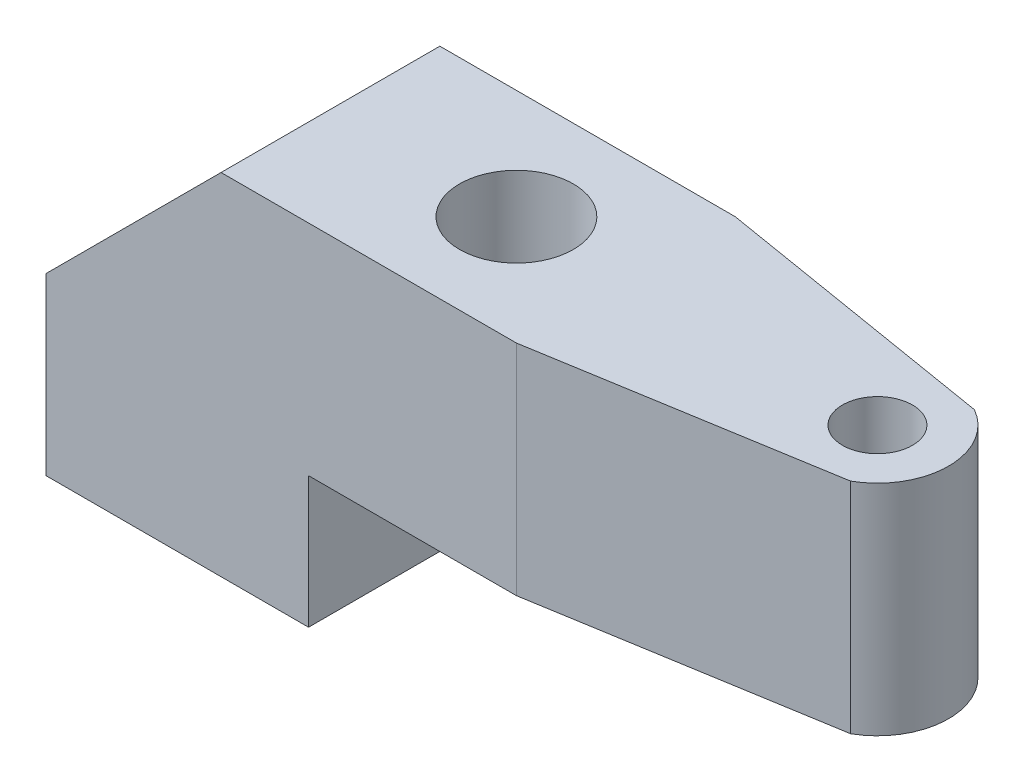
from build123d import *

# Parameters (mm, degrees)
SKETCH1_R             = 5.9875
SKETCH1_R_2           = 1.7
SKETCH1_R_3           = 1.6
BOSS_EXTRUDE1_DEPTH   = 6
MOVE_FACE1_BY         = 5
MOVE_FACE1_2_BY       = 5
MOVE_FACE1_3_BY       = 5
MOVE_FACE1_4_BY       = 5
M4X0_7_TAPPED_HOLE2_D = 3.3
POCKET_WALLS_DEPTH    = 2.6
RIB_PATTERN_DEPTH     = 3
MOVE_FACE2_BY         = 4.5
MOVE_FACE2_2_BY       = 4.5
MOVE_FACE2_3_BY       = 4.5
MOVE_FACE2_4_BY       = 4.5
MOVE_FACE2_5_BY       = 4.5
MOVE_FACE2_6_BY       = 4.5
MOVE_FACE2_7_BY       = 4.5
MOVE_FACE2_8_BY       = 4.5
MOVE_FACE2_9_BY       = 4.5
MOVE_FACE2_10_BY      = 4.5
MOVE_FACE2_11_BY      = 4.5
MOVE_FACE2_12_BY      = 4.5
MOVE_FACE2_13_BY      = 4.5
MOVE_FACE2_14_BY      = 4.5
BOSS_EXTRUDE6_REACH   = 382.427
SKETCH19_W            = 1
SKETCH19_H            = 3
BOSS_EXTRUDE7_REACH   = 375.768
SKETCH20_W            = 1
SKETCH20_H            = 3
CUT_EXTRUDE4_DEPTH    = 4.5
POCKET_FILLETS_R      = 2.5
FILLET9_R             = 3
MOVE_FACE3_BY         = 12
MOVE_FACE3_2_BY       = 12
SKETCH23_W            = 12
SKETCH23_H            = 38.175
CUT_EXTRUDE5_DEPTH    = 245.489391385
MOVE_FACE4_BY         = 4
MOVE_FACE4_2_BY       = 4
FILLET6_R             = 5
FILLET7_R             = 11
FILLET8_START         = -1
FILLET8_DEPTH         = 8
FILLET8_2_DEPTH       = 6
SKETCH25_R            = 1.6
SKETCH25_R_2          = 2.6
BOSS_EXTRUDE9_DEPTH   = 10
SKETCH26_W            = 12
SKETCH26_H            = 10
BOSS_EXTRUDE10_DEPTH  = 6
CHAMFER2_SIZE         = 8


with BuildPart() as part:
    # Sketch1 → Boss-Extrude1 (new body)
    with BuildSketch(Plane(origin=(0, 0, 0), x_dir=(1, 0, 0), z_dir=(0, 1, 0))):
        Polygon((-240, 46.25), (-198, 46.25), (-198, 26.5), (198, 26.5), (198, 46.25), (240, 46.25), (240, -18.75), (201, -18.75), (201, 0), (-201, 0), (-201, -18.75), (-240, -18.75), align=None)
        with Locations(Location((-231, 24.425, 0), (0, 0, 270))):
            Circle(SKETCH1_R, mode=Mode.SUBTRACT)
        with Locations(Location((-214.5, 37.25, 0), (0, 0, 270))):
            Circle(SKETCH1_R, mode=Mode.SUBTRACT)
        with Locations(Location((214.5, 37.25, 0), (0, 0, 90))):
            Circle(SKETCH1_R, mode=Mode.SUBTRACT)
        with Locations(Location((231, 24.425, 0), (0, 0, 90))):
            Circle(SKETCH1_R, mode=Mode.SUBTRACT)
        with Locations(Location((-204.5, -6.05, 0), (0, 0, 270))):
            Circle(SKETCH1_R_2, mode=Mode.SUBTRACT)
        with Locations(Location((-224.5, -6.05, 0), (0, 0, 270))):
            Circle(SKETCH1_R_2, mode=Mode.SUBTRACT)
        with Locations(Location((-204.5, 13.95, 0), (0, 0, 270))):
            Circle(SKETCH1_R_2, mode=Mode.SUBTRACT)
        with Locations(Location((-224.5, 13.95, 0), (0, 0, 270))):
            Circle(SKETCH1_R_2, mode=Mode.SUBTRACT)
        with Locations(Location((204.5, -6.05, 0), (0, 0, 90))):
            Circle(SKETCH1_R_2, mode=Mode.SUBTRACT)
        with Locations(Location((204.5, 13.95, 0), (0, 0, 90))):
            Circle(SKETCH1_R_2, mode=Mode.SUBTRACT)
        with Locations(Location((224.5, 13.95, 0), (0, 0, 90))):
            Circle(SKETCH1_R_2, mode=Mode.SUBTRACT)
        with Locations(Location((224.5, -6.05, 0), (0, 0, 90))):
            Circle(SKETCH1_R_2, mode=Mode.SUBTRACT)
        with Locations(Location((-187.5, 13.25, 0), (0, 0, 270))):
            Circle(SKETCH1_R_3, mode=Mode.SUBTRACT)
        with Locations(Location((-162.5, 13.25, 0), (0, 0, 270))):
            Circle(SKETCH1_R_3, mode=Mode.SUBTRACT)
        with Locations(Location((-137.5, 13.25, 0), (0, 0, 270))):
            Circle(SKETCH1_R_3, mode=Mode.SUBTRACT)
        with Locations(Location((-112.5, 13.25, 0), (0, 0, 270))):
            Circle(SKETCH1_R_3, mode=Mode.SUBTRACT)
        with Locations(Location((-87.5, 13.25, 0), (0, 0, 270))):
            Circle(SKETCH1_R_3, mode=Mode.SUBTRACT)
        with Locations(Location((-62.5, 13.25, 0), (0, 0, 270))):
            Circle(SKETCH1_R_3, mode=Mode.SUBTRACT)
        with Locations(Location((-37.5, 13.25, 0), (0, 0, 270))):
            Circle(SKETCH1_R_3, mode=Mode.SUBTRACT)
        with Locations(Location((-12.5, 13.25, 0), (0, 0, 270))):
            Circle(SKETCH1_R_3, mode=Mode.SUBTRACT)
        with Locations(Location((12.5, 13.25, 0), (0, 0, 270))):
            Circle(SKETCH1_R_3, mode=Mode.SUBTRACT)
        with Locations(Location((37.5, 13.25, 0), (0, 0, 270))):
            Circle(SKETCH1_R_3, mode=Mode.SUBTRACT)
        with Locations(Location((62.5, 13.25, 0), (0, 0, 270))):
            Circle(SKETCH1_R_3, mode=Mode.SUBTRACT)
        with Locations(Location((87.5, 13.25, 0), (0, 0, 270))):
            Circle(SKETCH1_R_3, mode=Mode.SUBTRACT)
        with Locations(Location((112.5, 13.25, 0), (0, 0, 270))):
            Circle(SKETCH1_R_3, mode=Mode.SUBTRACT)
        with Locations(Location((137.5, 13.25, 0), (0, 0, 270))):
            Circle(SKETCH1_R_3, mode=Mode.SUBTRACT)
        with Locations(Location((-231, 37.25, 0), (0, 0, 270))):
            Circle(SKETCH1_R_3, mode=Mode.SUBTRACT)
        with Locations(Location((231, 37.25, 0), (0, 0, 90))):
            Circle(SKETCH1_R_3, mode=Mode.SUBTRACT)
        with Locations(Location((162.5, 13.25, 0), (0, 0, 270))):
            Circle(SKETCH1_R_3, mode=Mode.SUBTRACT)
        with Locations(Location((187.5, 13.25, 0), (0, 0, 270))):
            Circle(SKETCH1_R_3, mode=Mode.SUBTRACT)
    extrude(amount=BOSS_EXTRUDE1_DEPTH)

    # Move Face1: a curved face moved outward by 5.0
    add(Solid.thicken(part.faces().sort_by_distance((231, 3, -18.4375))[0], MOVE_FACE1_BY))

    # Move Face1 2: a curved face moved outward by 5.0
    add(Solid.thicken(part.faces().sort_by_distance((214.5, 3, -31.2625))[0], MOVE_FACE1_2_BY))

    # Move Face1 3: a curved face moved outward by 5.0
    add(Solid.thicken(part.faces().sort_by_distance((-214.5, 3, -43.2375))[0], MOVE_FACE1_3_BY))

    # Move Face1 4: a curved face moved outward by 5.0
    add(Solid.thicken(part.faces().sort_by_distance((-231, 3, -30.4125))[0], MOVE_FACE1_4_BY))

    # M4x0.7 Tapped Hole2 (through all)
    with Locations(Plane(origin=(0, 6, 0), x_dir=(1, 0, 0), z_dir=(0, 1, 0))):
        with Locations((-214.5, 37.25), (-231, 24.425), (231, 24.425), (214.5, 37.25)):
            Hole(M4X0_7_TAPPED_HOLE2_D / 2)

    # Sketch13 → Pocket Walls (add)
    with BuildSketch(Plane.XY):
        Polygon((-214, 6), (-208.803847577, 9), (208.803847577, 9), (214, 6), align=None)
    pocket_walls = extrude(amount=-POCKET_WALLS_DEPTH)

    # Mirror1: Pocket Walls across plane
    add(pocket_walls.mirror(Plane.XY.offset(-13.25)))

    # zig_zag_style_1 → Rib Pattern (add)
    with BuildSketch(Plane(origin=(0, 6, 0), x_dir=(1, 0, 0), z_dir=(0, 1, 0))):
        Polygon((-186.851468198, 1.838812439), (-162.5, 22.586263345), (-137.5, 1.286263345), (-112.5, 22.586263345), (-87.5, 1.286263345), (-62.5, 22.586263345), (-37.5, 1.286263345), (-12.5, 22.586263345), (12.5, 1.286263345), (37.5, 22.586263345), (62.5, 1.286263345), (87.5, 22.586263345), (112.5, 1.286263345), (137.5, 22.586263345), (162.5, 1.286263345), (188.148531802, 23.138812439), (186.851468198, 24.661187561), (162.5, 3.913736655), (137.5, 25.213736655), (112.5, 3.913736655), (87.5, 25.213736655), (62.5, 3.913736655), (37.5, 25.213736655), (12.5, 3.913736655), (-12.5, 25.213736655), (-37.5, 3.913736655), (-62.5, 25.213736655), (-87.5, 3.913736655), (-112.5, 25.213736655), (-137.5, 3.913736655), (-162.5, 25.213736655), (-188.148531802, 3.361187561), align=None)
    extrude(amount=RIB_PATTERN_DEPTH)

    # Move Face2: a face moved inward by 4.5
    extrude(part.faces().sort_by_distance((162.5, 6, -17.307514961))[0], amount=MOVE_FACE2_BY, dir=(0, -1, 0), mode=Mode.SUBTRACT)

    # Move Face2 2: a face moved inward by 4.5
    extrude(part.faces().sort_by_distance((137.5, 6, -9.192485039))[0], amount=MOVE_FACE2_2_BY, dir=(0, -1, 0), mode=Mode.SUBTRACT)

    # Move Face2 3: a face moved inward by 4.5
    extrude(part.faces().sort_by_distance((112.5, 6, -17.307514961))[0], amount=MOVE_FACE2_3_BY, dir=(0, -1, 0), mode=Mode.SUBTRACT)

    # Move Face2 4: a face moved inward by 4.5
    extrude(part.faces().sort_by_distance((87.5, 6, -9.192485039))[0], amount=MOVE_FACE2_4_BY, dir=(0, -1, 0), mode=Mode.SUBTRACT)

    # Move Face2 5: a face moved inward by 4.5
    extrude(part.faces().sort_by_distance((62.5, 6, -17.307514961))[0], amount=MOVE_FACE2_5_BY, dir=(0, -1, 0), mode=Mode.SUBTRACT)

    # Move Face2 6: a face moved inward by 4.5
    extrude(part.faces().sort_by_distance((37.5, 6, -9.192485039))[0], amount=MOVE_FACE2_6_BY, dir=(0, -1, 0), mode=Mode.SUBTRACT)

    # Move Face2 7: a face moved inward by 4.5
    extrude(part.faces().sort_by_distance((12.5, 6, -17.307514961))[0], amount=MOVE_FACE2_7_BY, dir=(0, -1, 0), mode=Mode.SUBTRACT)

    # Move Face2 8: a face moved inward by 4.5
    extrude(part.faces().sort_by_distance((-12.5, 6, -9.192485039))[0], amount=MOVE_FACE2_8_BY, dir=(0, -1, 0), mode=Mode.SUBTRACT)

    # Move Face2 9: a face moved inward by 4.5
    extrude(part.faces().sort_by_distance((-37.5, 6, -17.307514961))[0], amount=MOVE_FACE2_9_BY, dir=(0, -1, 0), mode=Mode.SUBTRACT)

    # Move Face2 10: a face moved inward by 4.5
    extrude(part.faces().sort_by_distance((-62.5, 6, -9.192485039))[0], amount=MOVE_FACE2_10_BY, dir=(0, -1, 0), mode=Mode.SUBTRACT)

    # Move Face2 11: a face moved inward by 4.5
    extrude(part.faces().sort_by_distance((-87.5, 6, -17.307514961))[0], amount=MOVE_FACE2_11_BY, dir=(0, -1, 0), mode=Mode.SUBTRACT)

    # Move Face2 12: a face moved inward by 4.5
    extrude(part.faces().sort_by_distance((-112.5, 6, -9.192485039))[0], amount=MOVE_FACE2_12_BY, dir=(0, -1, 0), mode=Mode.SUBTRACT)

    # Move Face2 13: a face moved inward by 4.5
    extrude(part.faces().sort_by_distance((-162.5, 6, -9.192485039))[0], amount=MOVE_FACE2_13_BY, dir=(0, -1, 0), mode=Mode.SUBTRACT)

    # Move Face2 14: a face moved inward by 4.5
    extrude(part.faces().sort_by_distance((-137.5, 6, -17.307514961))[0], amount=MOVE_FACE2_14_BY, dir=(0, -1, 0), mode=Mode.SUBTRACT)

    # Boss-Extrude6: up to this face of the body (flat: up to its plane)
    boss_extrude6_end = Plane(part.part.faces().sort_by_distance((199.498029235, 7.445651316, -23.9))[0])
    # Sketch19 → Boss-Extrude6 (add, up to the picked face)
    with BuildSketch(Plane(origin=(120.437057913, 0, -102.612373342), x_dir=(-0.6485318015860708, 0, -0.7611875605470214), z_dir=(0.7611875605470213, 0, -0.6485318015860707)), mode=Mode.PRIVATE) as boss_extrude6_sk1:
        with Locations((-103.9073301, 7.5)):
            Rectangle(SKETCH19_W, SKETCH19_H)
    boss_extrude6_tool1 = split(extrude(boss_extrude6_sk1.sketch, amount=BOSS_EXTRUDE6_REACH, mode=Mode.PRIVATE), bisect_by=boss_extrude6_end, keep=Keep.BOTH, mode=Mode.PRIVATE)
    add(boss_extrude6_tool1.solids().sort_by(Axis((187.824266, 7.5, -23.519406), (0.7611875605470213, 0, -0.6485318015860707)))[0])

    # Boss-Extrude7: up to this face of the body (flat: up to its plane)
    boss_extrude7_end = Plane(part.part.faces().sort_by_distance((-199.498029235, 7.445651316, -2.6))[0])
    # Sketch20 → Boss-Extrude7 (add, up to the picked face)
    with BuildSketch(Plane(origin=(-107.355217903, 0, 91.466645654), x_dir=(0.6485318015860708, 0, 0.7611875605470213), z_dir=(-0.7611875605470213, 0, 0.6485318015860708)), mode=Mode.PRIVATE) as boss_extrude7_sk1:
        with Locations((-124.078800455, 7.5)):
            Rectangle(SKETCH20_W, SKETCH20_H)
    boss_extrude7_tool1 = split(extrude(boss_extrude7_sk1.sketch, amount=BOSS_EXTRUDE7_REACH, mode=Mode.PRIVATE), bisect_by=boss_extrude7_end, keep=Keep.BOTH, mode=Mode.PRIVATE)
    add(boss_extrude7_tool1.solids().sort_by(Axis((-187.824266, 7.5, -2.980594), (-0.7611875605470213, 0, 0.6485318015860708)))[0])

    # Sketch22 → Cut-Extrude4 (cut)
    with BuildSketch(Plane(origin=(0, 6, 0), x_dir=(1, 0, 0), z_dir=(0, 1, 0))):
        Polygon((-201, 2.6), (-201, 23.9), (-164.041944431, 23.9), (-189.041944431, 2.6), align=None)
        Polygon((201, 2.6), (201, 23.9), (189.041944431, 23.9), (164.041944431, 2.6), align=None)
    extrude(amount=-CUT_EXTRUDE4_DEPTH, mode=Mode.SUBTRACT)

    # Pocket FIllets
    pocket_fillets_edges = [part.edges().sort_by_distance(p)[0] for p in [
        (185.958055569, 5.25, -23.9),
        (139.041944431, 5.25, -23.9),
        (135.958055569, 5.25, -23.9),
        (89.041944431, 5.25, -23.9),
        (85.958055569, 5.25, -23.9),
        (39.041944431, 5.25, -23.9),
        (35.958055569, 5.25, -23.9),
        (-10.958055569, 5.25, -23.9),
        (-14.041944431, 5.25, -23.9),
        (-60.958055569, 5.25, -23.9),
        (-64.041944431, 5.25, -23.9),
        (-110.958055569, 5.25, -23.9),
        (-114.041944431, 5.25, -23.9),
        (-160.958055569, 5.25, -23.9),
        (-164.041944431, 5.25, -23.9),
        (164.041944431, 5.25, -2.6),
        (-185.958055569, 5.25, -2.6),
        (-139.041944431, 5.25, -2.6),
        (-135.958055569, 5.25, -2.6),
        (-89.041944431, 5.25, -2.6),
        (-85.958055569, 5.25, -2.6),
        (-39.041944431, 5.25, -2.6),
        (-35.958055569, 5.25, -2.6),
        (10.958055569, 5.25, -2.6),
        (14.041944431, 5.25, -2.6),
        (60.958055569, 5.25, -2.6),
        (64.041944431, 5.25, -2.6),
        (110.958055569, 5.25, -2.6),
        (114.041944431, 5.25, -2.6),
        (160.958055569, 5.25, -2.6),
        (137.5, 5.25, -22.586263345),
        (87.5, 5.25, -22.586263345),
        (37.5, 5.25, -22.586263345),
        (-12.5, 5.25, -22.586263345),
        (-62.5, 5.25, -22.586263345),
        (-112.5, 5.25, -22.586263345),
        (-162.5, 5.25, -22.586263345),
        (-137.5, 5.25, -3.913736655),
        (-87.5, 5.25, -3.913736655),
        (-37.5, 5.25, -3.913736655),
        (12.5, 5.25, -3.913736655),
        (62.5, 5.25, -3.913736655),
        (112.5, 5.25, -3.913736655),
        (162.5, 5.25, -3.913736655),
        (189.041944431, 5.25, -23.9),
        (-189.041944431, 5.25, -2.6),
    ]]
    fillet(pocket_fillets_edges, radius=POCKET_FILLETS_R)

    # Fillet9
    fillet9_edges = [part.edges().sort_by_distance(p)[0] for p in [
        (-201, 3.75, -2.6),
        (-201, 3.75, -23.9),
        (201, 3.75, -2.6),
        (201, 3.75, -23.9),
    ]]
    fillet(fillet9_edges, radius=FILLET9_R)

    # Move Face3: a face moved inward by 12.0
    extrude(part.faces().sort_by_distance((198, 3, -36.375))[0], amount=MOVE_FACE3_BY, dir=(1, 0, 0), mode=Mode.SUBTRACT)

    # Move Face3 2: a face moved inward by 12.0
    extrude(part.faces().sort_by_distance((-198, 3, -36.375))[0], amount=MOVE_FACE3_2_BY, dir=(-1, 0, 0), mode=Mode.SUBTRACT)

    # Sketch23 → Cut-Extrude5 (cut, through all)
    with BuildSketch(Plane(origin=(0, 6, 0), x_dir=(1, 0, 0), z_dir=(0, 1, 0))):
        with Locations((-234, 0.3375)):
            Rectangle(SKETCH23_W, SKETCH23_H)
        with Locations((234, 0.3375)):
            Rectangle(SKETCH23_W, SKETCH23_H)
    extrude(amount=-CUT_EXTRUDE5_DEPTH, mode=Mode.SUBTRACT)

    # Move Face4: a face moved inward by 4.0
    extrude(part.faces().sort_by_distance((-240, 3, -32.8375))[0], amount=MOVE_FACE4_BY, dir=(1, 0, 0), mode=Mode.SUBTRACT)

    # Move Face4 2: a face moved inward by 4.0
    extrude(part.faces().sort_by_distance((240, 3, -32.8375))[0], amount=MOVE_FACE4_2_BY, dir=(-1, 0, 0), mode=Mode.SUBTRACT)

    # Fillet6
    fillet6_edges = [part.edges().sort_by_distance(p)[0] for p in [
        (-210, 3, -46.25),
        (-210, 3, -26.5),
        (210, 3, -26.5),
        (210, 3, -46.25),
        (201, 3, 18.75),
        (201, 3, 0),
        (-201, 3, 0),
        (-201, 3, 18.75),
        (-228, 3, 18.75),
        (228, 3, 18.75),
    ]]
    fillet(fillet6_edges, radius=FILLET6_R)

    # Fillet7
    fillet7_edges = [part.edges().sort_by_distance(p)[0] for p in [
        (-236, 3, -46.25),
        (236, 3, -46.25),
    ]]
    fillet(fillet7_edges, radius=FILLET7_R)

    # Fillet8: read off the stored shape, not the designer's step
    # Fillet8 outline → Fillet8 (cut)
    with BuildSketch(Plane(origin=(0, 0, 0), x_dir=(1, 0, 0), z_dir=(0, 1, 0)).offset(FILLET8_START)):
        with BuildLine():
            Line((-236, 19.425), (-232, 19.425))
            ThreePointArc((-232, 19.425), (-234.828427125, 20.596572875), (-236, 23.425))
            Line((-236, 23.425), (-236, 19.425))
        make_face()
        with BuildLine():
            ThreePointArc((236, 23.425), (234.828427125, 20.596572875), (232, 19.425))
            Line((232, 19.425), (236, 19.425))
            Line((236, 19.425), (236, 23.425))
        make_face()
    extrude(amount=FILLET8_DEPTH, mode=Mode.SUBTRACT)

    # Fillet8 2 outline → Fillet8 2 (add)
    with BuildSketch(Plane(origin=(0, 0, 0), x_dir=(1, 0, 0), z_dir=(0, 1, 0))):
        with BuildLine():
            Line((-228, 19.425), (-232, 19.425))
            ThreePointArc((-232, 19.425), (-229.171572875, 18.253427125), (-228, 15.425))
            Line((-228, 15.425), (-228, 19.425))
        make_face()
        with BuildLine():
            Line((228, 19.425), (228, 15.425))
            ThreePointArc((228, 15.425), (229.171572875, 18.253427125), (232, 19.425))
            Line((232, 19.425), (228, 19.425))
        make_face()
    extrude(amount=FILLET8_2_DEPTH)


with BuildPart() as body_2:
    # Sketch25 → Boss-Extrude9 (new body)
    with BuildSketch(Plane(origin=(0, 6, 0), x_dir=(1, 0, 0), z_dir=(0, 1, 0))):
        with BuildLine():
            Line((198, 32.25), (198, 42.25))
            Line((198, 42.25), (219.5, 42.25))
            Line((219.5, 42.25), (232.6, 40.078869032))
            ThreePointArc((232.6, 40.078869032), (234.25, 37.25), (232.6, 34.421130968))
            Line((232.6, 34.421130968), (219.5, 32.25))
            Line((219.5, 32.25), (198, 32.25))
        make_face()
        with Locations(Location((231, 37.25, 0), (0, 0, 270))):
            Circle(SKETCH25_R, mode=Mode.SUBTRACT)
        with Locations(Location((214.5, 37.25, 0), (0, 0, 270))):
            Circle(SKETCH25_R_2, mode=Mode.SUBTRACT)
    extrude(amount=BOSS_EXTRUDE9_DEPTH)

    # Sketch26 → Boss-Extrude10 (add)
    with BuildSketch(Plane.XZ.offset(-6)):
        with Locations((204, -37.25)):
            Rectangle(SKETCH26_W, SKETCH26_H)
    extrude(amount=BOSS_EXTRUDE10_DEPTH)

    # Chamfer2
    chamfer2_edges = [body_2.edges().sort_by_distance(p)[0] for p in [
        (198, 16, -37.25),
    ]]
    chamfer(chamfer2_edges, length=CHAMFER2_SIZE)


solid = body_2.part
